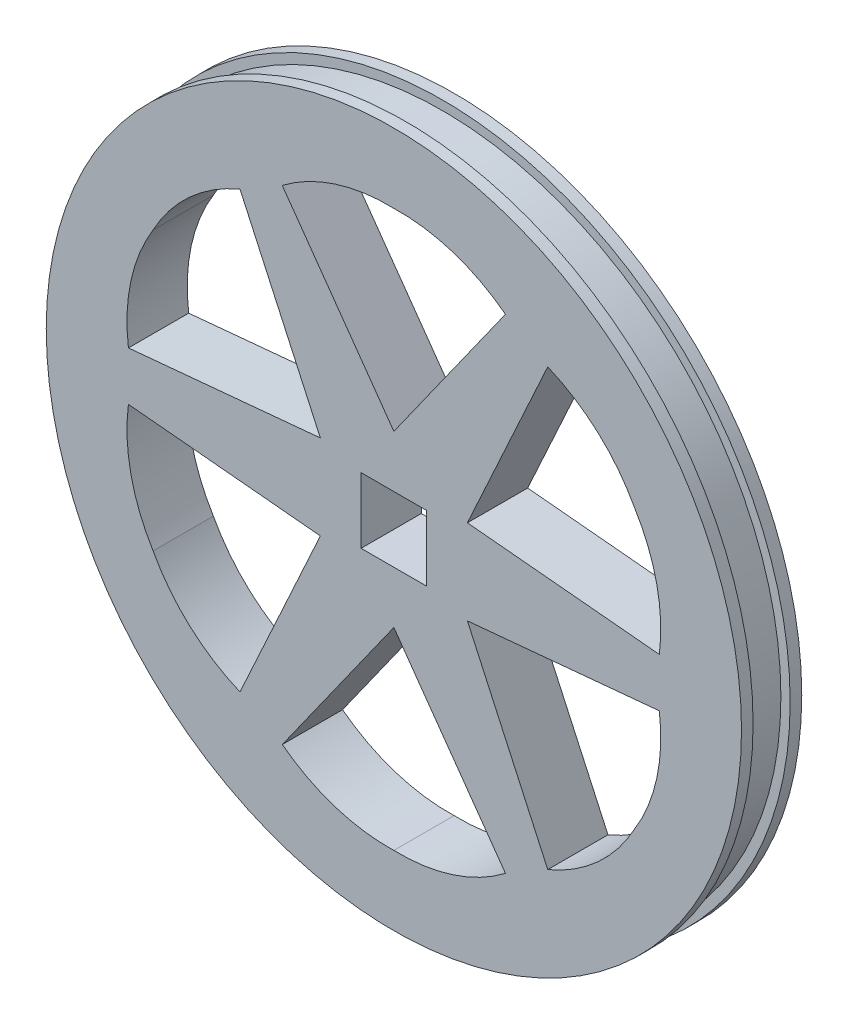
from build123d import *

# Parameters (mm, degrees)
SKETCH1_R           = 37.5
SKETCH1_W           = 7.071067812
SKETCH1_H           = 7.071067812
BOSS_EXTRUDE1_DEPTH = 3.25
CUT_EXTRUDE1_DEPTH  = 4
CIRPATTERN1_COUNT   = 6
SKETCH3_R           = 37.5
SKETCH3_R_2         = 36.5
CUT_EXTRUDE2_DEPTH  = 2


with BuildPart() as part:
    # Sketch1 → Boss-Extrude1 (new, symmetric)
    with BuildSketch(Plane.XY):
        Circle(SKETCH1_R)
        Rectangle(SKETCH1_W, SKETCH1_H, mode=Mode.SUBTRACT)
    extrude(amount=BOSS_EXTRUDE1_DEPTH, both=True)

    # Sketch2 → Cut-Extrude1 (cut, symmetric)
    with BuildSketch(Plane.XY):
        with BuildLine():
            Line((0, 9.158641407), (-12.037071564, 26.115211784))
            ThreePointArc((-12.037071564, 26.115211784), (-6.351662121, 29.087034336), (0, 29.988143709))
            ThreePointArc((0, 29.988143709), (6.351662121, 29.087034336), (12.037071564, 26.115211784))
            Line((12.037071564, 26.115211784), (0, 9.158641407))
        make_face()
    cut_extrude1 = extrude(amount=CUT_EXTRUDE1_DEPTH, both=True, mode=Mode.SUBTRACT)

    # CirPattern1: Cut-Extrude1 ×6 about axis
    cirpattern1_axis = Axis((0, 0, 3.25), (0, 0, -1))
    for i in range(1, CIRPATTERN1_COUNT):
        add(cut_extrude1.rotate(cirpattern1_axis, i * 360 / CIRPATTERN1_COUNT), mode=Mode.SUBTRACT)

    # Sketch3 → Cut-Extrude2 (cut, symmetric)
    with BuildSketch(Plane.XY):
        Circle(SKETCH3_R)
        Circle(SKETCH3_R_2, mode=Mode.SUBTRACT)
    extrude(amount=CUT_EXTRUDE2_DEPTH, both=True, mode=Mode.SUBTRACT)


solid = part.part
